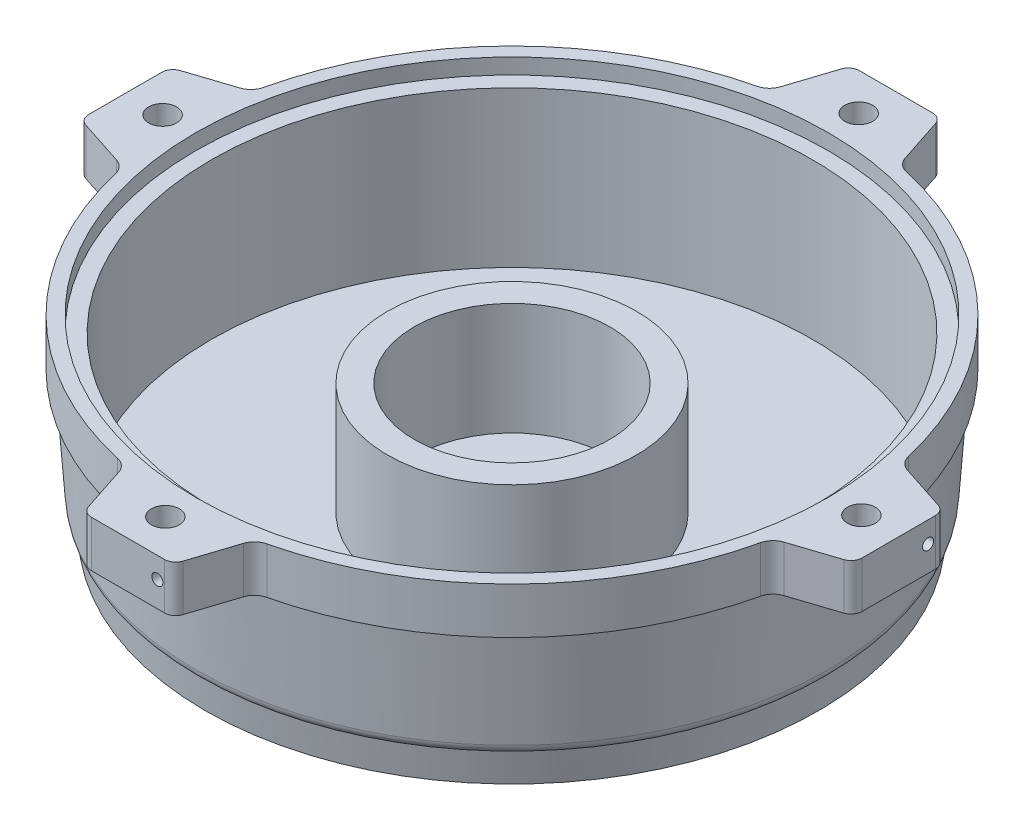
from build123d import *

# Parameters (mm, degrees)
BOSS_EXTRUDE2_DEPTH     = 8.3
CIRPATTERN1_COUNT       = 4
SKETCH13_R              = 22.4
CUT_EXTRUDE3_DEPTH      = 4
FILLET1_R               = 5
SKETCH15_R              = 18
SKETCH15_R_2            = 15
BOSS_EXTRUDE3_DEPTH     = 4
SKETCH16_R              = 7.5
CUT_EXTRUDE4_DEPTH      = 103.587698187
FILLET2_R               = 5
FILLET4_R               = 3
FILLET5_R               = 2
FILLET6_R               = 2
TAP_DRILL_FOR_M6_TAP1_D = 5
CIRPATTERN2_COUNT       = 4


with BuildPart() as part:
    # Sketch1 → Revolve1 (revolve)
    with BuildSketch(Plane.XY, mode=Mode.PRIVATE) as revolve1_sk:
        Polygon((22.3, -26.9), (53.8, -26.9), (53.8, 0.95810827), (56.6, 0.95810827), (56.6, 3.75810827), (59, 3.75810827), (59, 0), (59, -31.9), (0, -31.9), (0, -26.9), (17.5, -26.9), (17.5, -6.8), (22.3, -6.8), align=None)
    revolve(revolve1_sk.sketch.rotate(Axis((0, -26.9, 0), (0, -1, 0)), 180), axis=Axis((0, -26.9, 0), (0, -1, 0)))

    # Sketch2 → Boss-Extrude2 (add)
    with BuildSketch(Plane(origin=(0, 3.75810827, 0), x_dir=(1, 0, 0), z_dir=(0, 1, 0))):
        Polygon((7.756499668, 69), (-8.243500332, 69), (-11.893500332, 57.788793462), (11.406499668, 57.88688768), align=None)
    boss_extrude2 = extrude(amount=-BOSS_EXTRUDE2_DEPTH)

    # CirPattern1: Boss-Extrude2 ×4 about axis
    cirpattern1_axis = Axis((0, 0, 0), (0, 1, 0))
    for i in range(1, CIRPATTERN1_COUNT):
        add(boss_extrude2.rotate(cirpattern1_axis, i * 360 / CIRPATTERN1_COUNT))

    # Sketch10 → Cut-Revolve4 (revolve, cut)
    with BuildSketch(Plane(origin=(0, 0, 0), x_dir=(0, 0, -1), z_dir=(1, 0, 0)), mode=Mode.PRIVATE) as cut_revolve4_sk:
        Polygon((59.74122217, -25.056663082), (55.637901582, -24.521737202), (54.676040662, -31.9), (59.74122217, -32.409345916), align=None)
    revolve(cut_revolve4_sk.sketch.rotate(Axis((0, -1.306352148, 0), (0, -1, 0)), 281.147212692), axis=Axis((0, -1.306352148, 0), (0, -1, 0)), mode=Mode.SUBTRACT)

    # Sketch8 → Cut-Revolve5 (revolve, cut)
    with BuildSketch(Plane(origin=(0, 0, 0), x_dir=(0, 0, -1), z_dir=(1, 0, 0)), mode=Mode.PRIVATE) as cut_revolve5_sk:
        Polygon((57.88688768, -4.54189173), (59, -4.54189173), (59, -31.9), (56, -31.9), align=None)
    revolve(cut_revolve5_sk.sketch.rotate(Axis((0, 5.358719866, 0), (0, -1, 0)), 180), axis=Axis((0, 5.358719866, 0), (0, -1, 0)), mode=Mode.SUBTRACT)

    # Sketch12 → Cut-Revolve6 (revolve, cut)
    with BuildSketch(Plane(origin=(0, 0, 0), x_dir=(0, 0, -1), z_dir=(1, 0, 0))):
        Polygon((-55.049732908, -31.9), (-54.904154696, -30.15017811), (-17.788536772, -31.9), align=None)
    revolve(axis=Axis((0, 13.859698408, 0), (0, -1, 0)), mode=Mode.SUBTRACT)

    # Sketch13 → Cut-Extrude3 (cut)
    with BuildSketch(Plane.XZ.offset(31.9)):
        Circle(SKETCH13_R)
    extrude(amount=-CUT_EXTRUDE3_DEPTH, mode=Mode.SUBTRACT)

    # Fillet1
    # the kernel refuses this fillet: 5 mm, written as the material it takes off along each edge
    with BuildSketch(Plane(origin=(0, -31.68259181, 0), x_dir=(0, 0, 1), z_dir=(1, 0, 0))) as fillet1_piece_1:
        with BuildLine():
            CenterArc((27.185563904, -5.231169776), FILLET1_R, 87.300779723, 75.858290504)
            Line((22.4, -3.78259181), (22.304288722, -3.753620251))
            ThreePointArc((22.304288722, -3.753620251), (22.3, -1.891295905), (22.3, 0))
            Line((22.3, 0), (22.404709286, 0.099889052))
            Line((22.404709286, 0.099889052), (27.425737475, -0.136828145))
            Line((27.425737475, -0.136828145), (27.421028189, -0.236717197))
        make_face()
    revolve(axis=Axis((0, -31.68259181, 0), (0, -1, 0)), revolution_arc=270, mode=Mode.SUBTRACT)
    with BuildSketch(Plane(origin=(0, -31.68259181, 0), x_dir=(1, 0, 0), z_dir=(0, 0, -1))) as fillet1_piece_2:
        with BuildLine():
            CenterArc((27.185563904, -5.231169776), FILLET1_R, 87.300779723, 75.858290504)
            Line((22.4, -3.78259181), (22.304288722, -3.753620251))
            ThreePointArc((22.304288722, -3.753620251), (22.3, -1.891295905), (22.3, 0))
            Line((22.3, 0), (22.404709286, 0.099889052))
            Line((22.404709286, 0.099889052), (27.425737475, -0.136828145))
            Line((27.425737475, -0.136828145), (27.421028189, -0.236717197))
        make_face()
    revolve(axis=Axis((0, -31.68259181, 0), (0, -1, 0)), revolution_arc=90, mode=Mode.SUBTRACT)

    # Sketch15 → Boss-Extrude3 (add)
    with BuildSketch(Plane.XZ.offset(27.9)):
        Circle(SKETCH15_R)
        Circle(SKETCH15_R_2, mode=Mode.SUBTRACT)
    extrude(amount=BOSS_EXTRUDE3_DEPTH)

    # Sketch16 → Cut-Extrude4 (cut, through all)
    with BuildSketch(Plane.XZ.offset(27.9)):
        Circle(SKETCH16_R)
    extrude(amount=-CUT_EXTRUDE4_DEPTH, mode=Mode.SUBTRACT)

    # Fillet2
    fillet2_edges = [part.edges().sort_by_distance(p)[0] for p in [
        (-22.4, -27.9, 0),
    ]]
    fillet(fillet2_edges, radius=FILLET2_R)

    # Fillet4
    fillet4_edges = [part.edges().sort_by_distance(p)[0] for p in [
        (11.406499668, -0.39189173, -57.88688768),
        (-11.893500332, -0.39189173, -57.788793462),
        (-57.88688768, -0.39189173, -11.406499668),
        (-57.788793462, -0.39189173, 11.893500332),
        (-11.406499668, -0.39189173, 57.88688768),
        (11.893500332, -0.39189173, 57.788793462),
        (57.88688768, -0.39189173, 11.406499668),
        (57.788793462, -0.39189173, -11.893500332),
    ]]
    fillet(fillet4_edges, radius=FILLET4_R)

    # Fillet5
    fillet5_edges = [part.edges().sort_by_distance(p)[0] for p in [
        (-8.243500332, -0.39189173, -69),
        (7.756499668, -0.39189173, -69),
        (-69, -0.39189173, 8.243500332),
        (-69, -0.39189173, -7.756499668),
        (8.243500332, -0.39189173, 69),
        (-7.756499668, -0.39189173, 69),
        (69, -0.39189173, -8.243500332),
        (69, -0.39189173, 7.756499668),
    ]]
    fillet(fillet5_edges, radius=FILLET5_R)

    # Fillet6
    # the kernel refuses this fillet: 2 mm, written as the material it takes off along each edge
    with BuildSketch(Plane(origin=(0, -24.634269562, 0), x_dir=(0, 0, 1), z_dir=(-1, 0, 0))) as fillet6_piece_1:
        with BuildLine():
            CenterArc((54.622986935, 1.835886142), FILLET6_R, 300.494611252, 55.559949074)
            Line((55.637901582, 0.112532359), (55.658199875, 0.078065284))
            ThreePointArc((55.658199875, 0.078065284), (56.064338554, 0.016601804), (56.495946338, -0.039664376))
            Line((56.495946338, -0.039664376), (56.541022351, -0.00275226))
            Line((56.541022351, -0.00275226), (56.658152184, 1.695520873))
            Line((56.658152184, 1.695520873), (56.618246983, 1.698273133))
        make_face()
    revolve(axis=Axis((0, -24.634269562, 0), (0, 1, 0)), revolution_arc=258.852787308, mode=Mode.SUBTRACT)
    with BuildSketch(Plane(origin=(0, -24.634269562, 0), x_dir=(-0.9811336895007642, 0, -0.1933305028354758), z_dir=(0.1933305028354758, 0, -0.9811336895007642))) as fillet6_piece_2:
        with BuildLine():
            CenterArc((54.622986935, 1.835886142), FILLET6_R, 300.494611252, 55.559949074)
            Line((55.637901582, 0.112532359), (55.658199875, 0.078065284))
            ThreePointArc((55.658199875, 0.078065284), (56.064338554, 0.016601804), (56.495946338, -0.039664376))
            Line((56.495946338, -0.039664376), (56.541022351, -0.00275226))
            Line((56.541022351, -0.00275226), (56.658152184, 1.695520873))
            Line((56.658152184, 1.695520873), (56.618246983, 1.698273133))
        make_face()
    revolve(axis=Axis((0, -24.634269562, 0), (0, 1, 0)), revolution_arc=101.147212692, mode=Mode.SUBTRACT)

    # Tap Drill for M6 Tap1 (through all)
    with Locations(Plane(origin=(0, 3.75810827, 0), x_dir=(1, 0, 0), z_dir=(0, 1, 0))):
        with Locations((-0.243500332, 62.31716076), (62.31716076, 0.243500332), (0.243500332, -62.31716076), (-62.31716076, -0.243500332)):
            Hole(TAP_DRILL_FOR_M6_TAP1_D / 2)

    # Sketch34 → Ø2.0 (2) Diameter Hole4 (revolve, cut)
    with BuildSketch(Plane(origin=(69, 0, -5.5), x_dir=(0, 0, -1), z_dir=(0, 1, 0))):
        Polygon((0, 0), (0, 5.600860619), (1, 5), (1, 0), align=None)
    f_2_0_2_diameter_hole4 = revolve(axis=Axis((75.35, 0, -5.5), (-1, 0, 0)), mode=Mode.SUBTRACT)

    # CirPattern2: Ø2.0 (2) Diameter Hole4 ×4 about axis
    cirpattern2_axis = Axis((0, -26.9, 0), (0, 1, 0))
    for i in range(1, CIRPATTERN2_COUNT):
        add(f_2_0_2_diameter_hole4.rotate(cirpattern2_axis, i * 360 / CIRPATTERN2_COUNT), mode=Mode.SUBTRACT)


solid = part.part
